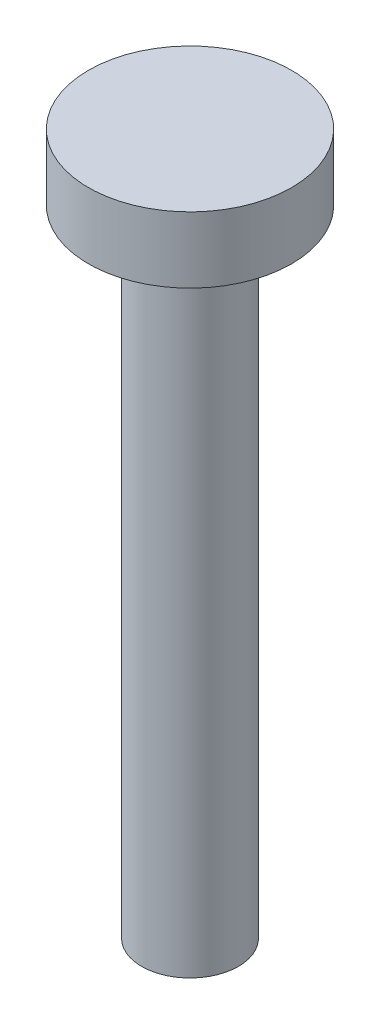
from build123d import *

# Parameters (mm, degrees)
REVOLVE1_ANGLE = 359.999695921


with BuildPart() as part:
    # Sketch1 → Revolve1 (revolve)
    with BuildSketch(Plane.XY):
        Polygon((0, 0), (4.7625, 0), (4.7625, 62.5), (10, 62.5), (10, 69), (0, 69), align=None)
    revolve(axis=Axis((0, 0, 0), (0, 1, 0)), revolution_arc=REVOLVE1_ANGLE)


solid = part.part
